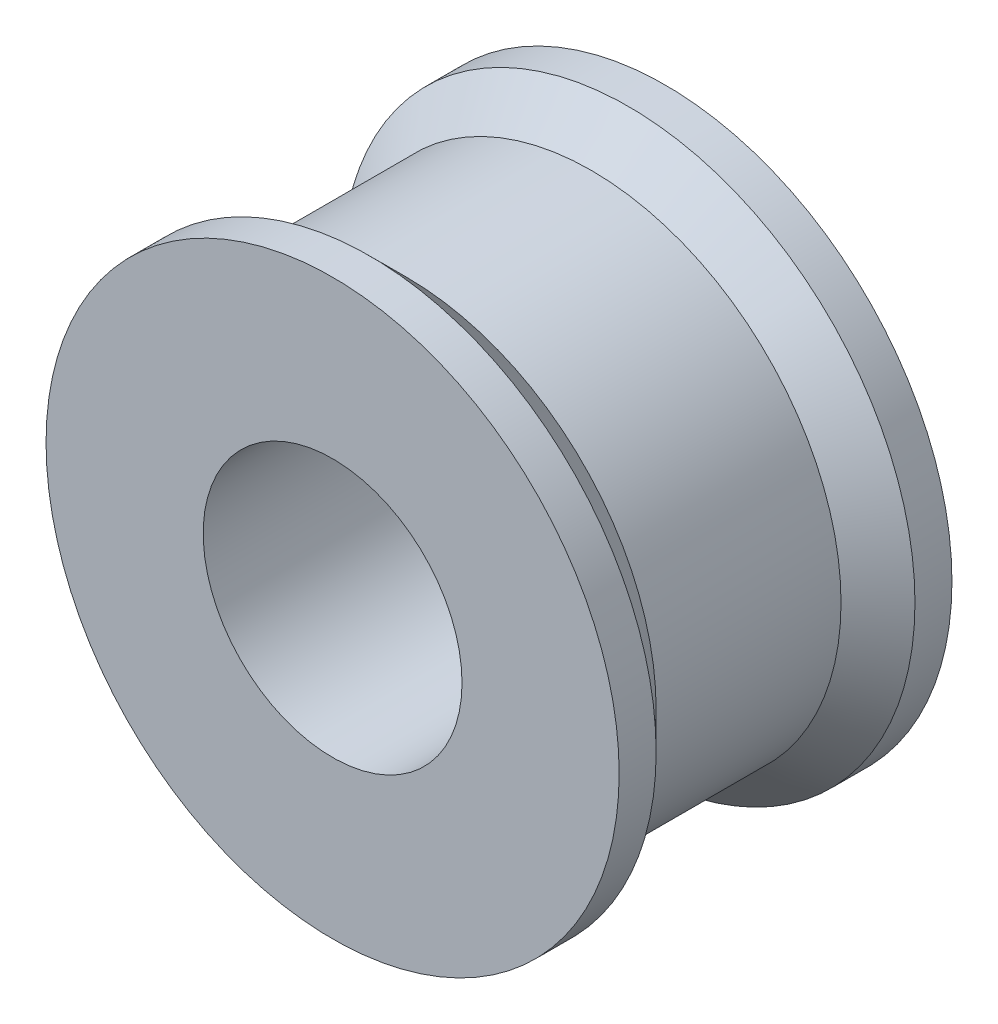
from build123d import *

# Parameters (mm, degrees)
SKETCH1_R           = 7.75
SKETCH1_R_2         = 3.5
BOSS_EXTRUDE1_DEPTH = 1
SKETCH2_R           = 6.75
SKETCH2_R_2         = 3.5
BOSS_EXTRUDE2_DEPTH = 3.5
CHAMFER1_SIZE       = 1


with BuildPart() as part:
    # Sketch1 → Boss-Extrude1 (new body)
    with BuildSketch(Plane.XY):
        Circle(SKETCH1_R)
        Circle(SKETCH1_R_2, mode=Mode.SUBTRACT)
    extrude(amount=BOSS_EXTRUDE1_DEPTH)

    # Sketch2 → Boss-Extrude2 (add)
    with BuildSketch(Plane.XY.offset(1)):
        Circle(SKETCH2_R)
        Circle(SKETCH2_R_2, mode=Mode.SUBTRACT)
    extrude(amount=BOSS_EXTRUDE2_DEPTH)

    # Chamfer1
    chamfer1_edges = [part.edges().sort_by_distance(p)[0] for p in [
        (-6.75, 0, 1),
    ]]
    chamfer(chamfer1_edges, length=CHAMFER1_SIZE - 0.0001)  # a hair under: the kernel refuses the full size

    # Mirror5: part across plane


with BuildPart() as part_1:
    add(part.part)
    add(part.part.mirror(Plane.XY.offset(4.5)))


solid = part_1.part
